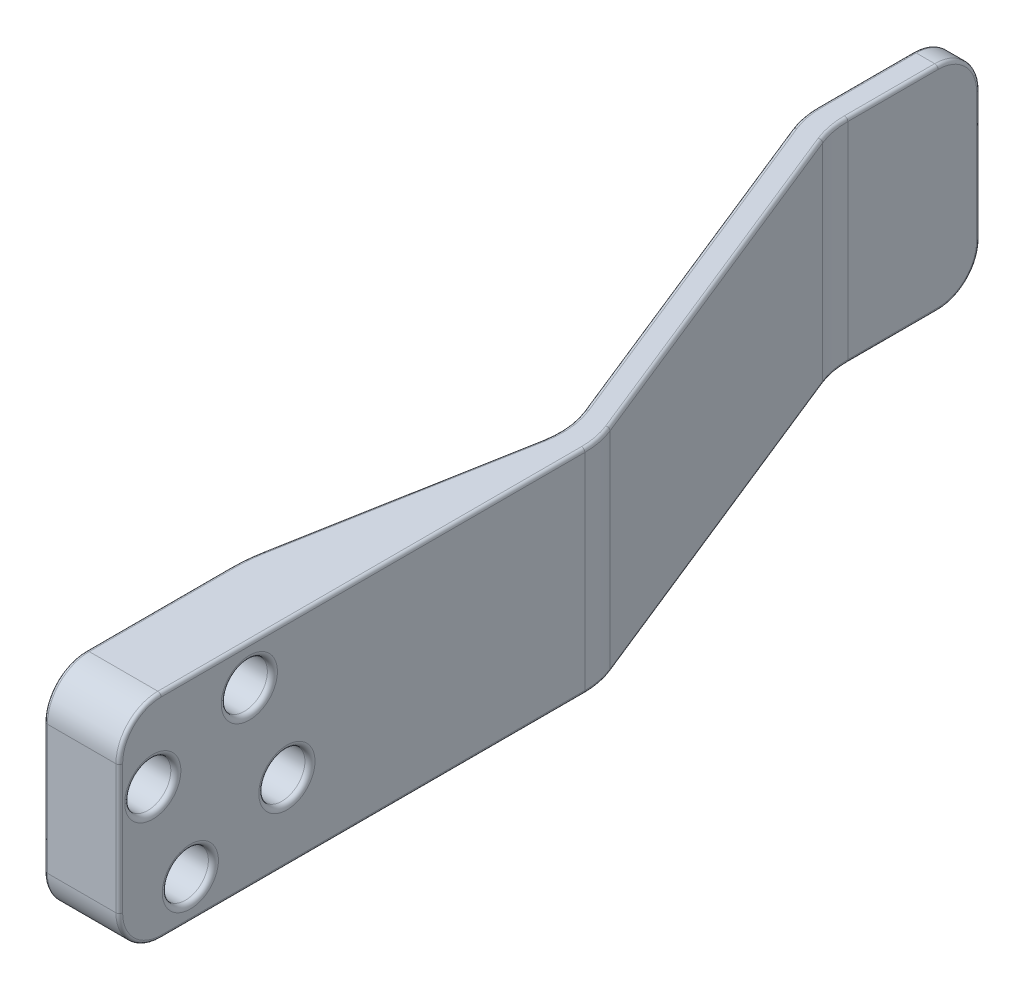
from build123d import *

# Parameters (mm, degrees)
SKETCH1_W           = 3
SKETCH1_H           = 25.4
SKETCH3_R           = 1.6
CUT_EXTRUDE1_DEPTH  = 124.745626185
SKETCH4_W           = 24
SKETCH4_H           = 25.4
SKETCH4_R           = 1.6
BOSS_EXTRUDE1_DEPTH = 5.98
BOSS_EXTRUDE2_DEPTH = 25.4
FILLET1_R           = 5
FILLET2_R           = 10
FILLET3_R           = 0.4
SKETCH5_R           = 2.75
CUT_EXTRUDE2_DEPTH  = 6.98
FILLET7_R           = 20
FILLET8_R           = 0.6


with BuildPart() as part:
    # Sweep1: sweep along a path in Sketch2
    with BuildLine(Plane(origin=(0, 0, 0), x_dir=(1, 0, 0), z_dir=(0, 1, 0))) as sweep1_path:
        Line((22.5, 0), (22.5, 57.2))
        Line((22.5, 57.2), (4, 103.2))
        Line((4, 103.2), (4, 121.2))
    # Sketch1 → Sweep1 (sweep)
    with BuildSketch(Plane.XY):
        with Locations((22.5, 0)):
            Rectangle(SKETCH1_W, SKETCH1_H)
    sweep(path=sweep1_path.line, transition=Transition.RIGHT)

    # Sketch3 → Cut-Extrude1 (cut, through all)
    with BuildSketch(Plane(origin=(24, 0, 0), x_dir=(0, 0, -1), z_dir=(1, 0, 0))):
        with Locations(Location((4, 3.51960225, 0), (0, 0, 90))):
            Circle(SKETCH3_R)
        with Locations(Location((15.51960225, 8, 0), (0, 0, 90))):
            Circle(SKETCH3_R)
        with Locations(Location((20, -3.51960225, 0), (0, 0, 90))):
            Circle(SKETCH3_R)
        with Locations(Location((8.48039775, -8, 0), (0, 0, 90))):
            Circle(SKETCH3_R)
    extrude(amount=-CUT_EXTRUDE1_DEPTH, mode=Mode.SUBTRACT)

    # Sketch4 → Boss-Extrude1 (add)
    with BuildSketch(Plane.ZY.offset(-21)):
        with Locations((-12, 0)):
            Rectangle(SKETCH4_W, SKETCH4_H)
        with Locations(Location((-15.51960225, 8, 0), (0, 0, 90))):
            Circle(SKETCH4_R, mode=Mode.SUBTRACT)
        with Locations(Location((-20, -3.51960225, 0), (0, 0, 90))):
            Circle(SKETCH4_R, mode=Mode.SUBTRACT)
        with Locations(Location((-8.48039775, -8, 0), (0, 0, 90))):
            Circle(SKETCH4_R, mode=Mode.SUBTRACT)
        with Locations(Location((-4, 3.51960225, 0), (0, 0, 90))):
            Circle(SKETCH4_R, mode=Mode.SUBTRACT)
    extrude(amount=BOSS_EXTRUDE1_DEPTH)

    # Sketch6 → Boss-Extrude2 (add, through all)
    with BuildSketch(Plane(origin=(0, 12.7, 0), x_dir=(1, 0, 0), z_dir=(0, 1, 0))):
        Polygon((15.02, 24), (21, 56.909669549), (21, 24), align=None)
    extrude(amount=-BOSS_EXTRUDE2_DEPTH)

    # Fillet1
    fillet1_edges = [part.edges().sort_by_distance(p)[0] for p in [
        (4, -12.7, -121.2),
        (4, 12.7, -121.2),
        (19.51, -12.7, 0),
        (19.51, 12.7, 0),
    ]]
    fillet(fillet1_edges, radius=FILLET1_R)

    # Fillet2
    fillet2_edges = [part.edges().sort_by_distance(p)[0] for p in [
        (24, 0, -57.490330451),
        (21, 0, -56.909669549),
        (2.5, 0, -102.909669549),
        (5.5, 0, -103.490330451),
    ]]
    fillet(fillet2_edges, radius=FILLET2_R)

    # Fillet3
    fillet3_edges = [part.edges().sort_by_distance(p)[0] for p in [
        (24, 0, 0),
        (15.02, 0, 0),
        (15.02, 12.7, -14.5),
        (15.02, -11.235533906, -1.464466094),
        (15.02, 11.235533906, -1.464466094),
        (24, -11.235533906, -1.464466094),
        (24, 11.235533906, -1.464466094),
        (5.5, 0, -121.2),
        (5.5, 11.235533906, -119.735533906),
        (5.5, -11.235533906, -119.735533906),
        (2.5, 0, -121.2),
        (2.5, 11.235533906, -119.735533906),
        (2.5, -11.235533906, -119.735533906),
        (17.751922638, 12.7, -39.034560409),
        (17.751922638, -12.7, -39.034560409),
        (11.572479026, -12.7, -80.351073052),
        (11.572479026, 12.7, -80.351073052),
        (5.5, -12.7, -110.812933396),
        (5.5, 12.7, -110.812933396),
        (14.75, 12.7, -80.490330451),
        (14.75, -12.7, -80.490330451),
        (2.5, -12.7, -110.522602945),
        (2.5, 12.7, -110.522602945),
        (24, 12.7, -30.277397055),
        (23.817788896, 12.7, -57.45506283),
        (2.682211104, 12.7, -102.94493717),
        (24, -12.7, -30.277397055),
        (23.817788896, -12.7, -57.45506283),
        (2.682211104, -12.7, -102.94493717),
        (20.593677924, -12.7, -56.868361443),
        (20.593677924, 12.7, -56.868361443),
        (5.682211104, -12.7, -103.525598072),
        (5.682211104, 12.7, -103.525598072),
        (15.02, -12.7, -14.5),
    ]]
    fillet(fillet3_edges, radius=FILLET3_R)

    # Sketch5 → Cut-Extrude2 (cut)
    with BuildSketch(Plane(origin=(24, 0, 0), x_dir=(0, 0, -1), z_dir=(1, 0, 0))):
        with Locations(Location((4, 3.51960225, 0), (0, 0, 90))):
            Circle(SKETCH5_R)
        with Locations(Location((15.51960225, 8, 0), (0, 0, 90))):
            Circle(SKETCH5_R)
        with Locations(Location((20, -3.51960225, 0), (0, 0, 90))):
            Circle(SKETCH5_R)
        with Locations(Location((8.48039775, -8, 0), (0, 0, 90))):
            Circle(SKETCH5_R)
    extrude(amount=-CUT_EXTRUDE2_DEPTH, mode=Mode.SUBTRACT)

    # Fillet7
    # the kernel refuses this fillet: 20 mm, written as the material it takes off along each edge
    with BuildSketch(Plane(origin=(35.02, 12.7, -22.197661615), x_dir=(-0.9838887223692693, 0, -0.17878193978857884), z_dir=(0.17878193978857884, 0, -0.9838887223692693))) as fillet7_piece_1:
        with BuildLine():
            CenterArc((19.6, -0.4), 0.4, 0, 90)
            Line((20, -0.4), (20, 0))
            Line((20, 0), (19.6, 0))
        make_face()
    revolve(axis=Axis((35.02, 12.7, -22.197661615), (0, 1, 0)), revolution_arc=10.298819284, mode=Mode.SUBTRACT)
    with BuildSketch(Plane(origin=(35.02, -12.7, -22.197661615), x_dir=(-1, 0, 0), z_dir=(0, 0, 1))) as fillet7_piece_2:
        with BuildLine():
            CenterArc((19.6, -0.4), 0.4, 0, 90)
            Line((20, -0.4), (20, 0))
            Line((20, 0), (19.6, 0))
        make_face()
    revolve(axis=Axis((35.02, -12.7, -22.197661615), (0, -1, 0)), revolution_arc=10.298819284, mode=Mode.SUBTRACT)
    with BuildSketch(Plane(origin=(15.02, -12.7, -24), x_dir=(0, 0, 1), z_dir=(0, 1, 0))) as fillet7_piece_3:
        with BuildLine():
            CenterArc((FILLET7_R * 0.0901169192469, FILLET7_R), FILLET7_R, 259.701180716, 10.298819284)
            Line((-FILLET7_R * 0.0886650205417, FILLET7_R * 0.0161112776307), (0, 0))
            Line((0, 0), (FILLET7_R * 0.0901169192469, 0))
        make_face()
    extrude(amount=25.4, mode=Mode.SUBTRACT)

    # Fillet8
    fillet8_edges = [part.edges().sort_by_distance(p)[0] for p in [
        (24, 0.76960225, -4),
        (24, 5.25, -15.51960225),
        (24, -6.26960225, -20),
        (24, -10.75, -8.48039775),
    ]]
    fillet(fillet8_edges, radius=FILLET8_R)


solid = part.part
